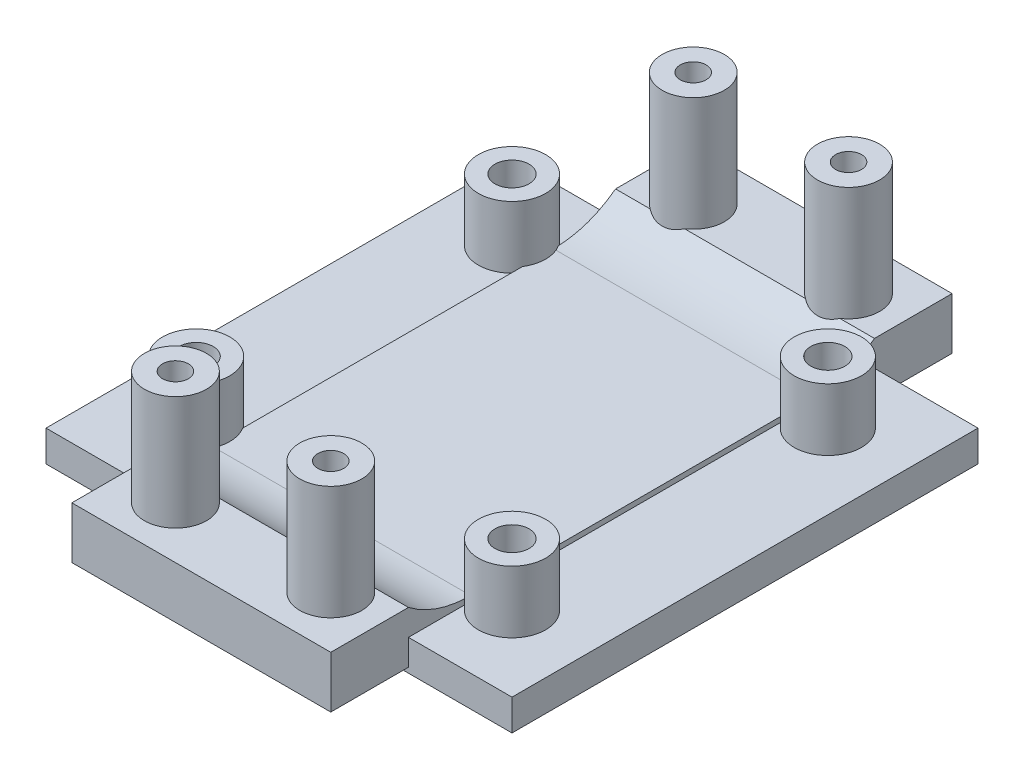
from build123d import *

# Parameters (mm, degrees)
SKETCH1_R               = 3.25
SKETCH1_R_2             = 1.65
BOSS_EXTRUDE1_DEPTH     = 6
BOSS_EXTRUDE1_2_DEPTH   = 6
BOSS_EXTRUDE1_3_DEPTH   = 6
BOSS_EXTRUDE1_4_DEPTH   = 6
SKETCH2_W               = 45
SKETCH2_H               = 45
BOSS_EXTRUDE2_DEPTH     = 3
CUT_EXTRUDE1_START      = -3
SKETCH1_2_R             = 1.65
CUT_EXTRUDE1_DEPTH      = 3
BOSS_EXTRUDE4_START     = -2.5
SKETCH3_W               = 25
SKETCH3_H               = 7.5
BOSS_EXTRUDE4_DEPTH     = 3
BOSS_EXTRUDE5_START     = 0.5
SKETCH4_R               = 3
SKETCH4_R_2             = 1.25
BOSS_EXTRUDE5_DEPTH     = 13
CUT_EXTRUDE2_DEPTH      = 40.855990767
CUT_EXTRUDE2_DEPTH_BACK = 40.855990767
SKETCH4_2_R             = 1.25
SKETCH3_4_W             = 25
SKETCH3_4_H             = 7.5
BOSS_EXTRUDE6_DEPTH     = 2.5
FILLET2_START           = -12.5
FILLET2_DEPTH           = 25


with BuildPart() as part:
    # Sketch1 → Boss-Extrude1 (new body)
    with BuildSketch(Plane(origin=(0, 0, 0), x_dir=(1, 0, 0), z_dir=(0, 1, 0))):
        with Locations(Location((-15.25, 15.25, 0), (0, 0, 270))):
            Circle(SKETCH1_R)
        with Locations(Location((-15.25, 15.25, 0), (0, 0, 270))):
            Circle(SKETCH1_R_2, mode=Mode.SUBTRACT)
    extrude(amount=BOSS_EXTRUDE1_DEPTH)



with BuildPart() as body_2:
    # Sketch1 → Boss-Extrude1 2 (new body)
    with BuildSketch(Plane(origin=(0, 0, 0), x_dir=(1, 0, 0), z_dir=(0, 1, 0))):
        with Locations(Location((15.25, 15.25, 0), (0, 0, 270))):
            Circle(SKETCH1_R)
        with Locations(Location((15.25, 15.25, 0), (0, 0, 270))):
            Circle(SKETCH1_R_2, mode=Mode.SUBTRACT)
    extrude(amount=BOSS_EXTRUDE1_2_DEPTH)


with BuildPart() as body_3:
    # Sketch1 → Boss-Extrude1 3 (new body)
    with BuildSketch(Plane(origin=(0, 0, 0), x_dir=(1, 0, 0), z_dir=(0, 1, 0))):
        with Locations(Location((15.25, -15.25, 0), (0, 0, 270))):
            Circle(SKETCH1_R)
        with Locations(Location((15.25, -15.25, 0), (0, 0, 270))):
            Circle(SKETCH1_R_2, mode=Mode.SUBTRACT)
    extrude(amount=BOSS_EXTRUDE1_3_DEPTH)


with BuildPart() as body_4:
    # Sketch1 → Boss-Extrude1 4 (new body)
    with BuildSketch(Plane(origin=(0, 0, 0), x_dir=(1, 0, 0), z_dir=(0, 1, 0))):
        with Locations(Location((-15.25, -15.25, 0), (0, 0, 270))):
            Circle(SKETCH1_R)
        with Locations(Location((-15.25, -15.25, 0), (0, 0, 270))):
            Circle(SKETCH1_R_2, mode=Mode.SUBTRACT)
    extrude(amount=BOSS_EXTRUDE1_4_DEPTH)


with BuildPart() as part_1:
    add(part.part)

    add(body_2.part)  # Boss-Extrude2 merges body 2

    add(body_3.part)  # Boss-Extrude2 merges body 3

    add(body_4.part)  # Boss-Extrude2 merges body 4
    # Sketch2 → Boss-Extrude2 (add)
    with BuildSketch(Plane(origin=(0, 0, 0), x_dir=(1, 0, 0), z_dir=(0, 1, 0))):
        Rectangle(SKETCH2_W, SKETCH2_H)
    extrude(amount=-BOSS_EXTRUDE2_DEPTH)

    # Sketch1<2> → Cut-Extrude1 (cut)
    with BuildSketch(Plane(origin=(0, 0, 0), x_dir=(1, 0, 0), z_dir=(0, 1, 0)).offset(CUT_EXTRUDE1_START)):
        with Locations(Location((-15.25, 15.25, 0), (0, 0, 270))):
            Circle(SKETCH1_2_R)
        with Locations(Location((-15.25, -15.25, 0), (0, 0, 270))):
            Circle(SKETCH1_2_R)
        with Locations(Location((15.25, -15.25, 0), (0, 0, 270))):
            Circle(SKETCH1_2_R)
        with Locations(Location((15.25, 15.25, 0), (0, 0, 270))):
            Circle(SKETCH1_2_R)
    extrude(amount=CUT_EXTRUDE1_DEPTH, mode=Mode.SUBTRACT)

    # Sketch3 → Boss-Extrude4 (add)
    with BuildSketch(Plane(origin=(0, 0, 0), x_dir=(1, 0, 0), z_dir=(0, 1, 0)).offset(BOSS_EXTRUDE4_START)):
        with Locations((0, 26.25)):
            Rectangle(SKETCH3_W, SKETCH3_H)
        with BuildLine():
            Line((-12.5, -16.982050808), (-12.5, -22.5))
            Line((-12.5, -22.5), (12.5, -22.5))
            Line((12.5, -22.5), (12.5, -16.982050808))
            ThreePointArc((12.5, -16.982050808), (12, -15.25), (12.5, -13.517949192))
            Line((12.5, -13.517949192), (12.5, 13.517949192))
            ThreePointArc((12.5, 13.517949192), (12, 15.25), (12.5, 16.982050808))
            Line((12.5, 16.982050808), (12.5, 22.5))
            Line((12.5, 22.5), (-12.5, 22.5))
            Line((-12.5, 22.5), (-12.5, 16.982050808))
            ThreePointArc((-12.5, 16.982050808), (-12.127501001, 16.151387819), (-12, 15.25))
            ThreePointArc((-12, 15.25), (-12.127501001, 14.348612181), (-12.5, 13.517949192))
            Line((-12.5, 13.517949192), (-12.5, -13.517949192))
            ThreePointArc((-12.5, -13.517949192), (-12.127501001, -14.348612181), (-12, -15.25))
            ThreePointArc((-12, -15.25), (-12.127501001, -16.151387819), (-12.5, -16.982050808))
        make_face()
        with Locations((0, -26.25)):
            Rectangle(SKETCH3_W, SKETCH3_H)
    extrude(amount=BOSS_EXTRUDE4_DEPTH)

    # Sketch4 → Boss-Extrude5 (add)
    # profile 1 of 4: a face of its own
    with BuildSketch(Plane(origin=(0, 0, 0), x_dir=(1, 0, 0), z_dir=(0, 1, 0)).offset(BOSS_EXTRUDE5_START)):
        with Locations(Location((-7.5, 25, 0), (0, 0, 90))):
            Circle(SKETCH4_R)
        with Locations(Location((-7.5, 25, 0), (0, 0, 90))):
            Circle(SKETCH4_R_2, mode=Mode.SUBTRACT)
    # profile 2 of 4: a face of its own
    with BuildSketch(Plane(origin=(0, 0, 0), x_dir=(1, 0, 0), z_dir=(0, 1, 0)).offset(BOSS_EXTRUDE5_START)):
        with Locations(Location((7.5, 25, 0), (0, 0, 90))):
            Circle(SKETCH4_R)
        with Locations(Location((7.5, 25, 0), (0, 0, 90))):
            Circle(SKETCH4_R_2, mode=Mode.SUBTRACT)
    # profile 3 of 4: a face of its own
    with BuildSketch(Plane(origin=(0, 0, 0), x_dir=(1, 0, 0), z_dir=(0, 1, 0)).offset(BOSS_EXTRUDE5_START)):
        with Locations(Location((-7.5, -25, 0), (0, 0, 90))):
            Circle(SKETCH4_R)
        with Locations(Location((-7.5, -25, 0), (0, 0, 90))):
            Circle(SKETCH4_R_2, mode=Mode.SUBTRACT)
    # profile 4 of 4: a face of its own
    with BuildSketch(Plane(origin=(0, 0, 0), x_dir=(1, 0, 0), z_dir=(0, 1, 0)).offset(BOSS_EXTRUDE5_START)):
        with Locations(Location((7.5, -25, 0), (0, 0, 90))):
            Circle(SKETCH4_R)
        with Locations(Location((7.5, -25, 0), (0, 0, 90))):
            Circle(SKETCH4_R_2, mode=Mode.SUBTRACT)
    extrude(amount=BOSS_EXTRUDE5_DEPTH)

    # Sketch4<2> → Cut-Extrude2 (cut, two sides: drawn at the far end of the back side and taken through both)
    with BuildSketch(Plane(origin=(0, 0, 0), x_dir=(1, 0, 0), z_dir=(0, 1, 0)).offset(-CUT_EXTRUDE2_DEPTH_BACK)):
        with Locations(Location((-7.5, 25, 0), (0, 0, 90))):
            Circle(SKETCH4_2_R)
        with Locations(Location((7.5, 25, 0), (0, 0, 90))):
            Circle(SKETCH4_2_R)
        with Locations(Location((7.5, -25, 0), (0, 0, 90))):
            Circle(SKETCH4_2_R)
        with Locations(Location((-7.5, -25, 0), (0, 0, 90))):
            Circle(SKETCH4_2_R)
    extrude(amount=CUT_EXTRUDE2_DEPTH + CUT_EXTRUDE2_DEPTH_BACK, mode=Mode.SUBTRACT)

    # Sketch3<4> → Boss-Extrude6 (add)
    with BuildSketch(Plane(origin=(0, 0, 0), x_dir=(1, 0, 0), z_dir=(0, 1, 0))):
        with Locations((0, -26.25)):
            Rectangle(SKETCH3_4_W, SKETCH3_4_H)
        with Locations((0, 26.25)):
            Rectangle(SKETCH3_4_W, SKETCH3_4_H)
    extrude(amount=BOSS_EXTRUDE6_DEPTH)

    # Fillet2: read off the stored shape, not the designer's step
    # Fillet2 outline → Fillet2 (add)
    with BuildSketch(Plane.YZ.offset(FILLET2_START)):
        with BuildLine():
            add(Edge.make_bspline(
                [(0.5, -16.5), (0.5, -19.833333333), (2.5, -22.5)],
                knots=[0, 0, 0, 1, 1, 1], degree=2))
            Line((0.5, -16.5), (0.5, -22.5))
            Line((0.5, -22.5), (2.5, -22.5))
        make_face()
        with BuildLine():
            Line((0.5, 22.5), (0.5, 16.5))
            add(Edge.make_bspline(
                [(0.5, 16.5), (0.5, 19.833333333), (2.5, 22.5)],
                knots=[0, 0, 0, 1, 1, 1], degree=2))
            Line((2.5, 22.5), (0.5, 22.5))
        make_face()
    extrude(amount=FILLET2_DEPTH)


solid = part_1.part
